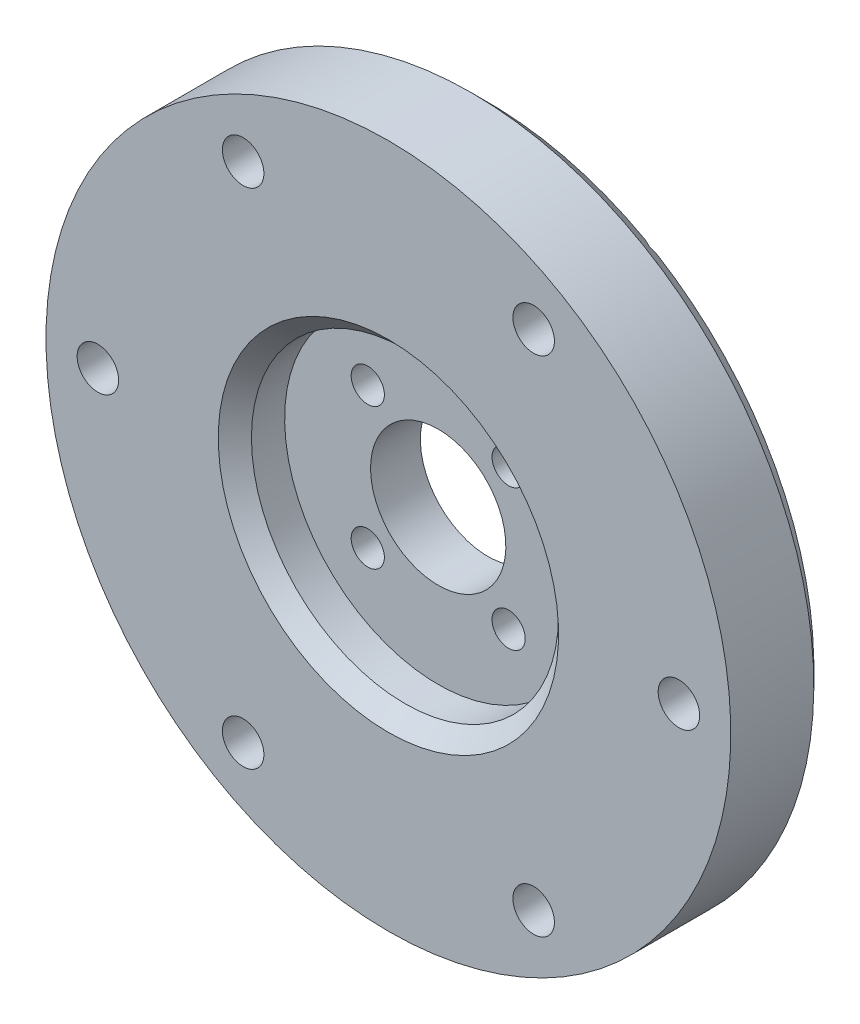
from build123d import *

# Parameters (mm, degrees)
SKETCH_2_R          = 2.5
SKETCH_2_R_2        = 2
CUT_EXTRUDE_1_DEPTH = 60.557745088
CUT_EXTRUDE_2_DEPTH = 6
CHAMFER_1_SIZE      = 2


with BuildPart() as part:
    # 草图1 → 旋转1 (revolve)
    with BuildSketch(Plane(origin=(0, 0, 0), x_dir=(0, 0, -1), z_dir=(1, 0, 0))):
        Polygon((0, 41.25), (0, 18.5), (6, 18.5), (6, 8.15), (12, 8.15), (12, 41.25), align=None)
    revolve(axis=Axis((0, 0, -14), (0, 0, 1)))

    # 草图2 → 切除-拉伸1 (cut, through all)
    with BuildSketch(Plane.XY):
        with Locations((-17.5, 30.310889132)):
            Circle(SKETCH_2_R)
        with Locations((17.5, 30.310889132)):
            Circle(SKETCH_2_R)
        with Locations((35, 0)):
            Circle(SKETCH_2_R)
        with Locations((17.5, -30.310889132)):
            Circle(SKETCH_2_R)
        with Locations((-17.5, -30.310889132)):
            Circle(SKETCH_2_R)
        with Locations((-35, 0)):
            Circle(SKETCH_2_R)
        with Locations((-8.485281374, 8.485281374)):
            Circle(SKETCH_2_R_2)
        with Locations((8.485281374, 8.485281374)):
            Circle(SKETCH_2_R_2)
        with Locations((8.485281374, -8.485281374)):
            Circle(SKETCH_2_R_2)
        with Locations((-8.485281374, -8.485281374)):
            Circle(SKETCH_2_R_2)
    extrude(amount=-CUT_EXTRUDE_1_DEPTH, mode=Mode.SUBTRACT)

    # 草图3 → 切除-拉伸2 (cut)
    with BuildSketch(Plane(origin=(0, 0, -12), x_dir=(-1, 0, 0), z_dir=(0, 0, -1))):
        Polygon((-12.82346282, 30.310889132), (-15.16173141, 34.360889132), (-19.83826859, 34.360889132), (-22.17653718, 30.310889132), (-19.83826859, 26.260889132), (-15.16173141, 26.260889132), align=None)
        Polygon((19.83826859, 26.260889132), (22.17653718, 30.310889132), (19.83826859, 34.360889132), (15.16173141, 34.360889132), (12.82346282, 30.310889132), (15.16173141, 26.260889132), align=None)
        Polygon((32.66173141, -4.05), (37.33826859, -4.05), (39.67653718, 0), (37.33826859, 4.05), (32.66173141, 4.05), (30.32346282, 0), align=None)
        Polygon((19.83826859, -26.260889132), (15.16173141, -26.260889132), (12.82346282, -30.310889132), (15.16173141, -34.360889132), (19.83826859, -34.360889132), (22.17653718, -30.310889132), align=None)
        Polygon((-15.16173141, -26.260889132), (-19.83826859, -26.260889132), (-22.17653718, -30.310889132), (-19.83826859, -34.360889132), (-15.16173141, -34.360889132), (-12.82346282, -30.310889132), align=None)
        Polygon((-32.66173141, 4.05), (-37.33826859, 4.05), (-39.67653718, 0), (-37.33826859, -4.05), (-32.66173141, -4.05), (-30.32346282, 0), align=None)
    extrude(amount=-CUT_EXTRUDE_2_DEPTH, mode=Mode.SUBTRACT)

    # 倒角1
    # the kernel refuses this chamfer: 2 mm, written as the material it takes off along each edge
    with BuildSketch(Plane(origin=(0, 0, -12), x_dir=(0, 1, 0), z_dir=(1, 0, 0))) as chamfer_1_piece_1:
        Polygon((41.25, CHAMFER_1_SIZE), (41.25 - CHAMFER_1_SIZE, 0), (41.25, 0), align=None)
    revolve(axis=Axis((0, 0, -12), (0, 0, 1)), mode=Mode.SUBTRACT)
    with BuildSketch(Plane(origin=(0, 0, 0), x_dir=(0, 1, 0), z_dir=(1, 0, 0))) as chamfer_1_piece_2:
        Polygon((18.5 + CHAMFER_1_SIZE, 0), (18.5, -CHAMFER_1_SIZE), (18.5, 0), align=None)
    revolve(axis=Axis((0, 0, 0), (0, 0, 1)), mode=Mode.SUBTRACT)


solid = part.part
